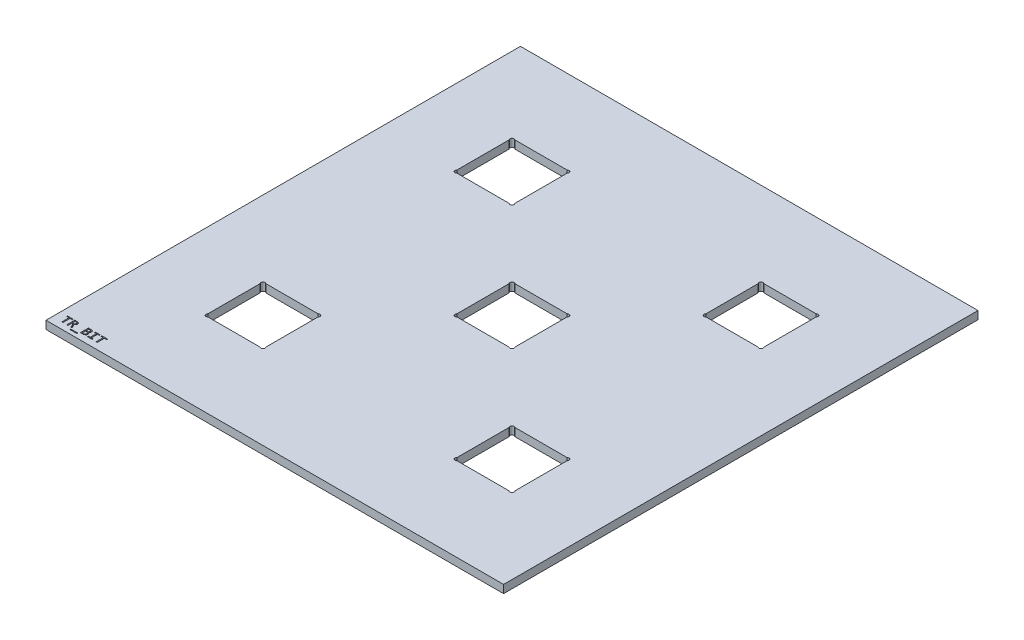
from build123d import *

# Parameters (mm, degrees)
SKETCH1_W           = 180.848
SKETCH1_H           = 187.5155
BOSS_EXTRUDE1_DEPTH = 3.175
SKETCH2_W           = 22.86
SKETCH2_H           = 22.86
CUT_EXTRUDE1_DEPTH  = 3.175
SKETCH3_R           = 0.79375
CUT_EXTRUDE2_DEPTH  = 131.296186
SKETCH4_W           = 2.714855072
SKETCH4_H           = 0.368115942
CUT_EXTRUDE3_DEPTH  = 1.5875


with BuildPart() as part:
    # Sketch1 → Boss-Extrude1 (new body)
    with BuildSketch(Plane(origin=(0, 0, 0), x_dir=(1, 0, 0), z_dir=(0, 1, 0))):
        Rectangle(SKETCH1_W, SKETCH1_H)
    extrude(amount=BOSS_EXTRUDE1_DEPTH)

    # Sketch2 → Cut-Extrude1 (cut)
    with BuildSketch(Plane(origin=(0, 3.175, 0), x_dir=(1, 0, 0), z_dir=(0, 1, 0))):
        Rectangle(SKETCH2_W, SKETCH2_H)
    cut_extrude1 = extrude(amount=-CUT_EXTRUDE1_DEPTH, mode=Mode.SUBTRACT)

    # Sketch3 → Cut-Extrude2 (cut, through all)
    with BuildSketch(Plane(origin=(0, 3.175, 0), x_dir=(1, 0, 0), z_dir=(0, 1, 0))):
        with Locations((-10.868733992, 10.868733992)):
            Circle(SKETCH3_R)
        with Locations((10.868733992, 10.868733992)):
            Circle(SKETCH3_R)
        with Locations((10.868733992, -10.868733992)):
            Circle(SKETCH3_R)
        with Locations((-10.868733992, -10.868733992)):
            Circle(SKETCH3_R)
    cut_extrude2 = extrude(amount=-CUT_EXTRUDE2_DEPTH, mode=Mode.SUBTRACT)

    # Sketch-Pattern1: Cut-Extrude1, Cut-Extrude2 at 4 more places
    with Locations((-49.2125, 0, 49.2125), (-49.2125, 0, -49.2125), (49.2125, 0, -49.2125), (49.2125, 0, 49.2125)):
        add(cut_extrude1, mode=Mode.SUBTRACT)
        add(cut_extrude2, mode=Mode.SUBTRACT)

    # Sketch4 → Cut-Extrude3 (cut)
    # profile 1 of 6: a face of its own
    with BuildSketch(Plane(origin=(0, 3.175, 0), x_dir=(1, 0, 0), z_dir=(0, 1, 0))):
        Polygon((-85.353202899, -88.410865942), (-86.273492754, -88.410865942), (-86.273492754, -91.21775), (-86.733637681, -91.21775), (-86.733637681, -88.410865942), (-87.653927536, -88.410865942), (-87.653927536, -88.04275), (-85.353202899, -88.04275), align=None)
    # profile 2 of 6: a face of its own
    with BuildSketch(Plane(origin=(0, 3.175, 0), x_dir=(1, 0, 0), z_dir=(0, 1, 0))):
        with BuildLine():
            Line((-82.638347826, -91.21775), (-83.125813859, -91.21775))
            Line((-83.125813859, -91.21775), (-83.582363904, -90.226281476))
            add(Edge.make_bspline(
                [(-83.582363904, -90.226281476), (-83.598860974, -90.191130284), (-83.629465089, -90.125920458), (-83.683350175, -90.040294449), (-83.73916016, -89.971305876), (-83.799615044, -89.918268069), (-83.865569382, -89.879574558), (-83.937441008, -89.854540538), (-84.016272547, -89.839988328), (-84.071201483, -89.838235213), (-84.100026947, -89.837315217)],
                knots=[0, 0, 0, 0, 1.339134837, 2.484261414, 3.482991323, 4.391871607, 5.244507385, 6.105289549, 7.005698766, 8, 8, 8, 8], degree=3))
            Line((-84.100026947, -89.837315217), (-84.294869565, -89.837315217))
            Line((-84.294869565, -89.837315217), (-84.294869565, -91.21775))
            Line((-84.294869565, -91.21775), (-84.755014493, -91.21775))
            Line((-84.755014493, -91.21775), (-84.755014493, -88.04275))
            Line((-84.755014493, -88.04275), (-83.910936141, -88.04275))
            add(Edge.make_bspline(
                [(-83.910936141, -88.04275), (-83.866571096, -88.043324801), (-83.781034279, -88.044433032), (-83.657527264, -88.056115686), (-83.543677978, -88.074962175), (-83.439661951, -88.102534986), (-83.344774287, -88.136226928), (-83.258689811, -88.176489474), (-83.181396775, -88.223089264), (-83.113190469, -88.276260019), (-83.052893824, -88.334285294), (-83.002293397, -88.399280748), (-82.959385051, -88.469287391), (-82.925710385, -88.545372647), (-82.900177177, -88.626034235), (-82.88111807, -88.710889782), (-82.870477515, -88.800037309), (-82.869113537, -88.860918232), (-82.86842029, -88.891861187)],
                knots=[0, 0, 0, 0, 1.390037284, 2.680023546, 3.883960013, 5.002565466, 6.047913656, 7.03574216, 7.976084698, 8.870016629, 9.741095147, 10.591561451, 11.444313202, 12.308368875, 13.191986167, 14.092206828, 15.030357037, 16, 16, 16, 16], degree=3))
            add(Edge.make_bspline(
                [(-82.86842029, -88.891861187), (-82.868994868, -88.916809205), (-82.870124847, -88.965872567), (-82.878430329, -89.038414802), (-82.89100624, -89.108963136), (-82.909849703, -89.177190844), (-82.933612198, -89.242831971), (-82.962310371, -89.305834559), (-82.997136135, -89.36550299), (-83.036557213, -89.422458811), (-83.081411438, -89.475782218), (-83.130948802, -89.525652899), (-83.18635394, -89.570899919), (-83.245486917, -89.613413484), (-83.309965112, -89.651029424), (-83.379136935, -89.683170015), (-83.452650391, -89.710818718), (-83.503864807, -89.724616993), (-83.529878623, -89.731625679)],
                knots=[0, 0, 0, 0, 1.032708305, 2.030948508, 3.019625047, 3.996933367, 4.957424013, 5.907556856, 6.85893238, 7.814077788, 8.77200233, 9.740252168, 10.719774328, 11.730219428, 12.753012585, 13.805036997, 14.885091985, 16, 16, 16, 16], degree=3))
            add(Edge.make_bspline(
                [(-83.529878623, -89.731625679), (-83.508734767, -89.739380778), (-83.466783942, -89.754767413), (-83.409104807, -89.789031767), (-83.354855427, -89.828859176), (-83.307413111, -89.879758478), (-83.261027139, -89.937088784), (-83.215047309, -90.003148469), (-83.168355492, -90.077696238), (-83.138952467, -90.131452504), (-83.123656929, -90.159416667)],
                knots=[0, 0, 0, 0, 0.890820497, 1.767447404, 2.649001527, 3.549193506, 4.515009134, 5.571837998, 6.736863216, 8, 8, 8, 8], degree=3))
            Line((-83.123656929, -90.159416667), (-82.638347826, -91.21775))
        make_face()
        with BuildLine():
            add(Edge.make_bspline(
                [(-83.328565217, -88.922777174), (-83.328901843, -88.901906114), (-83.32955407, -88.861467484), (-83.336773162, -88.802931226), (-83.34912625, -88.74858325), (-83.365581675, -88.698221992), (-83.386140981, -88.651372969), (-83.413407518, -88.609650848), (-83.444183923, -88.571263632), (-83.479733549, -88.537216471), (-83.519769509, -88.507597987), (-83.563758214, -88.481855754), (-83.611291845, -88.459414038), (-83.662835579, -88.441302724), (-83.718322956, -88.428061778), (-83.777599298, -88.41773837), (-83.840852671, -88.41224996), (-83.884324813, -88.411335157), (-83.906622283, -88.410865942)],
                knots=[0, 0, 0, 0, 1.136086502, 2.201219443, 3.204852043, 4.166451082, 5.083443327, 5.98129036, 6.87199526, 7.758098985, 8.653381414, 9.577773354, 10.529401831, 11.511765708, 12.546811162, 13.632454437, 14.78565276, 16, 16, 16, 16], degree=3))
            Line((-83.906622283, -88.410865942), (-84.294869565, -88.410865942))
            Line((-84.294869565, -88.410865942), (-84.294869565, -89.469199275))
            Line((-84.294869565, -89.469199275), (-83.961983469, -89.469199275))
            add(Edge.make_bspline(
                [(-83.961983469, -89.469199275), (-83.93824743, -89.468775061), (-83.891881464, -89.467946402), (-83.824245057, -89.461800526), (-83.760525642, -89.449675605), (-83.700090994, -89.435336816), (-83.643820366, -89.415000628), (-83.592001738, -89.390397511), (-83.543763099, -89.362541635), (-83.500833591, -89.329095915), (-83.461473321, -89.292318472), (-83.427024794, -89.251260372), (-83.397057325, -89.206291797), (-83.372862702, -89.156799379), (-83.3522013, -89.103890377), (-83.339197548, -89.046440031), (-83.330033673, -88.985862033), (-83.329062587, -88.944144192), (-83.328565217, -88.922777174)],
                knots=[0, 0, 0, 0, 1.202615583, 2.349188572, 3.435207305, 4.486530095, 5.492783739, 6.45958443, 7.390413995, 8.308405015, 9.210274755, 10.115082188, 11.017605575, 11.940721498, 12.901403136, 13.887978084, 14.918265918, 16, 16, 16, 16], degree=3))
        make_face(mode=Mode.SUBTRACT)
    # profile 3 of 6: a face of its own
    with BuildSketch(Plane(origin=(0, 3.175, 0), x_dir=(1, 0, 0), z_dir=(0, 1, 0))):
        with Locations((-81.096862319, -92.04601087)):
            Rectangle(SKETCH4_W, SKETCH4_H)
    # profile 4 of 6: a face of its own
    with BuildSketch(Plane(origin=(0, 3.175, 0), x_dir=(1, 0, 0), z_dir=(0, 1, 0))):
        with BuildLine():
            add(Edge.make_bspline(
                [(-77.300666667, -90.256478487), (-77.301767408, -90.293929266), (-77.303916628, -90.367052676), (-77.320759558, -90.473189263), (-77.348005833, -90.573001284), (-77.38692422, -90.665931999), (-77.43648218, -90.751801926), (-77.493981353, -90.831853883), (-77.562241143, -90.903949147), (-77.6396186, -90.968793102), (-77.725718864, -91.026528496), (-77.820300053, -91.076706576), (-77.923229564, -91.120132703), (-78.034429642, -91.155730594), (-78.15300213, -91.183451777), (-78.278120993, -91.203821947), (-78.409843128, -91.214989694), (-78.49989964, -91.216816295), (-78.545933877, -91.21775)],
                knots=[0, 0, 0, 0, 1.013216857, 1.978326566, 2.900521816, 3.80762901, 4.696652207, 5.578905641, 6.469134838, 7.376056482, 8.306156408, 9.269586241, 10.269510869, 11.325927403, 12.425683058, 13.562442612, 14.753992443, 16, 16, 16, 16], degree=3))
            Line((-78.545933877, -91.21775), (-79.371318841, -91.21775))
            Line((-79.371318841, -91.21775), (-79.371318841, -88.04275))
            Line((-79.371318841, -88.04275), (-78.458937726, -88.04275))
            add(Edge.make_bspline(
                [(-78.458937726, -88.04275), (-78.415776923, -88.043171305), (-78.332222251, -88.043986906), (-78.211327188, -88.05393778), (-78.098609009, -88.067679445), (-77.994182637, -88.088203549), (-77.898285108, -88.115948787), (-77.809991763, -88.147610533), (-77.730514356, -88.186599133), (-77.659442607, -88.23147315), (-77.596067661, -88.28174973), (-77.541935424, -88.339261014), (-77.495367382, -88.402028876), (-77.457743947, -88.471343702), (-77.428163159, -88.546400313), (-77.407445232, -88.627549956), (-77.395186792, -88.714378614), (-77.393541304, -88.774148172), (-77.392695652, -88.804865036)],
                knots=[0, 0, 0, 0, 1.388776146, 2.688521212, 3.90167895, 5.042289038, 6.109239049, 7.11226345, 8.057476407, 8.951978552, 9.813306123, 10.653548746, 11.486644475, 12.322022467, 13.184316581, 14.076721024, 15.011585489, 16, 16, 16, 16], degree=3))
            add(Edge.make_bspline(
                [(-77.392695652, -88.804865036), (-77.394187829, -88.845716953), (-77.397092057, -88.925227163), (-77.420465455, -89.040231165), (-77.459482567, -89.146199347), (-77.504703675, -89.227097931), (-77.548888272, -89.286037834), (-77.587262923, -89.327182959), (-77.63058913, -89.365156859), (-77.678325997, -89.400685977), (-77.731080807, -89.433021183), (-77.788816355, -89.462453202), (-77.851312239, -89.489051092), (-77.895156559, -89.503989589), (-77.91754846, -89.511618886)],
                knots=[0, 0, 0, 0, 1.542514348, 3.00220039, 4.41170875, 5.794260582, 6.486040375, 7.190794555, 7.915677968, 8.659981338, 9.436469499, 10.250434215, 11.106472525, 12, 12, 12, 12], degree=3))
            add(Edge.make_bspline(
                [(-77.91754846, -89.511618886), (-77.87664368, -89.52138252), (-77.794952297, -89.540881581), (-77.69877587, -89.584147488), (-77.626119669, -89.625464199), (-77.575453465, -89.662078725), (-77.52784107, -89.702208006), (-77.483872937, -89.7470422), (-77.44350785, -89.795968992), (-77.407265864, -89.849224875), (-77.376677228, -89.907458977), (-77.348810265, -89.96901986), (-77.327568021, -90.035403794), (-77.311528408, -90.105578127), (-77.302101832, -90.179769245), (-77.30115142, -90.230568553), (-77.300666667, -90.256478487)],
                knots=[0, 0, 0, 0, 1.670885493, 3.336943679, 4.174711656, 4.995358125, 5.821090152, 6.65083528, 7.491206374, 8.34319308, 9.209637874, 10.10658404, 11.029731221, 11.978595832, 12.968992875, 14, 14, 14, 14], degree=3))
        make_face()
        with BuildLine():
            add(Edge.make_bspline(
                [(-77.85284058, -88.864540082), (-77.854161122, -88.833734621), (-77.856753897, -88.773250649), (-77.875402457, -88.700093166), (-77.897242037, -88.645331886), (-77.919347424, -88.60738698), (-77.947588932, -88.572860108), (-77.980772524, -88.541382551), (-78.019214895, -88.512019396), (-78.064494712, -88.487086054), (-78.115808229, -88.464860097), (-78.173491667, -88.445492372), (-78.238113978, -88.42957659), (-78.31047592, -88.41815795), (-78.390767081, -88.41204341), (-78.446944803, -88.411269086), (-78.476193161, -88.410865942)],
                knots=[0, 0, 0, 0, 1.467350645, 2.88102155, 3.572915596, 4.274650825, 4.965411238, 5.692918483, 6.45179769, 7.26549663, 8.150919223, 9.115896111, 10.16367939, 11.321101063, 12.605258578, 14, 14, 14, 14], degree=3))
            Line((-78.476193161, -88.410865942), (-78.911173913, -88.410865942))
            Line((-78.911173913, -88.410865942), (-78.911173913, -89.37717029))
            Line((-78.911173913, -89.37717029), (-78.49057269, -89.37717029))
            add(Edge.make_bspline(
                [(-78.49057269, -89.37717029), (-78.444696492, -89.375694942), (-78.356911508, -89.372871835), (-78.250692628, -89.35378391), (-78.173249825, -89.331332692), (-78.121468475, -89.308054353), (-78.072480474, -89.283616777), (-78.028835265, -89.252923081), (-77.988728878, -89.219097156), (-77.953534545, -89.180905973), (-77.92287595, -89.138813833), (-77.897680681, -89.092359062), (-77.877342165, -89.041771711), (-77.863140955, -88.986682116), (-77.854316788, -88.927136465), (-77.853344367, -88.885902411), (-77.85284058, -88.864540082)],
                knots=[0, 0, 0, 0, 2.073538655, 3.967755928, 4.862618563, 5.712230629, 6.531505899, 7.334196252, 8.118305519, 8.900614993, 9.67674368, 10.467342855, 11.284464589, 12.136217, 13.034420764, 14, 14, 14, 14], degree=3))
        make_face(mode=Mode.SUBTRACT)
        with BuildLine():
            add(Edge.make_bspline(
                [(-77.760811594, -90.273014946), (-77.761288763, -90.253085269), (-77.762225678, -90.213953551), (-77.771847595, -90.156726005), (-77.78761894, -90.102682223), (-77.809520058, -90.051850198), (-77.836570675, -90.004209361), (-77.870248318, -89.960957686), (-77.90863738, -89.92069802), (-77.953307965, -89.885006521), (-78.00326612, -89.853546666), (-78.057735842, -89.825120785), (-78.117411303, -89.80079497), (-78.182173689, -89.780869375), (-78.251622709, -89.764982077), (-78.325406869, -89.753843571), (-78.403656965, -89.746206424), (-78.457240624, -89.745598922), (-78.484820879, -89.745286232)],
                knots=[0, 0, 0, 0, 0.948445084, 1.862262358, 2.754366203, 3.623615494, 4.492864785, 5.355796555, 6.227589923, 7.136690505, 8.070741307, 9.035595869, 10.059344591, 11.135152229, 12.259281394, 13.44900263, 14.686966176, 16, 16, 16, 16], degree=3))
            Line((-78.484820879, -89.745286232), (-78.911173913, -89.745286232))
            Line((-78.911173913, -89.745286232), (-78.911173913, -90.849634058))
            Line((-78.911173913, -90.849634058), (-78.47044135, -90.849634058))
            add(Edge.make_bspline(
                [(-78.47044135, -90.849634058), (-78.441427747, -90.849264013), (-78.385480287, -90.848550449), (-78.304349458, -90.84185132), (-78.228786402, -90.831613893), (-78.159194988, -90.815617802), (-78.095172075, -90.79622008), (-78.036524019, -90.772887579), (-77.984110327, -90.74375948), (-77.936450768, -90.711542959), (-77.895152566, -90.673498072), (-77.858799326, -90.63098716), (-77.828566956, -90.582834844), (-77.803342481, -90.530299179), (-77.783834378, -90.472855434), (-77.770317732, -90.410634095), (-77.762520159, -90.343433535), (-77.761393583, -90.297001648), (-77.760811594, -90.273014946)],
                knots=[0, 0, 0, 0, 1.326701194, 2.558302104, 3.720902774, 4.811133236, 5.820090824, 6.778795896, 7.691204955, 8.557756331, 9.403467856, 10.251165954, 11.10865784, 11.996033528, 12.91113804, 13.8765245, 14.903013039, 16, 16, 16, 16], degree=3))
        make_face(mode=Mode.SUBTRACT)
    # profile 5 of 6: a face of its own
    with BuildSketch(Plane(origin=(0, 3.175, 0), x_dir=(1, 0, 0), z_dir=(0, 1, 0))):
        Polygon((-75.874217391, -88.410865942), (-76.610449275, -88.410865942), (-76.610449275, -88.04275), (-74.67784058, -88.04275), (-74.67784058, -88.410865942), (-75.414072464, -88.410865942), (-75.414072464, -90.849634058), (-74.67784058, -90.849634058), (-74.67784058, -91.21775), (-76.610449275, -91.21775), (-76.610449275, -90.849634058), (-75.874217391, -90.849634058), align=None)
    # profile 6 of 6: a face of its own
    with BuildSketch(Plane(origin=(0, 3.175, 0), x_dir=(1, 0, 0), z_dir=(0, 1, 0))):
        Polygon((-71.778927536, -88.410865942), (-72.699217391, -88.410865942), (-72.699217391, -91.21775), (-73.159362319, -91.21775), (-73.159362319, -88.410865942), (-74.079652174, -88.410865942), (-74.079652174, -88.04275), (-71.778927536, -88.04275), align=None)
    extrude(amount=-CUT_EXTRUDE3_DEPTH, mode=Mode.SUBTRACT)


solid = part.part
